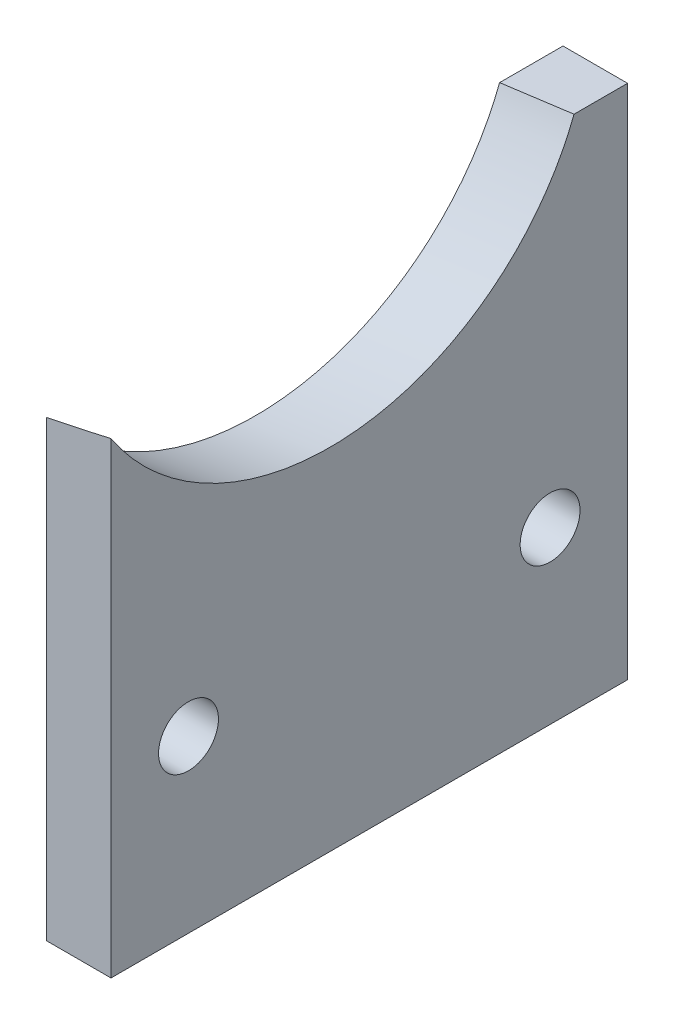
from build123d import *

# Parameters (mm, degrees)
SKETCH1_W           = 25.4
SKETCH1_H           = 25.4
BOSS_EXTRUDE1_DEPTH = 3.175
SKETCH6_R           = 1.4732
CUT_EXTRUDE2_DEPTH  = 19.238986403
SKETCH7_R           = 12.7
BOSS_EXTRUDE2_DEPTH = 2540


with BuildPart() as part:
    # Sketch1 → Boss-Extrude1 (new body)
    with BuildSketch(Plane(origin=(0, 0, 0), x_dir=(0, 0, -1), z_dir=(1, 0, 0))):
        Rectangle(SKETCH1_W, SKETCH1_H)
    extrude(amount=BOSS_EXTRUDE1_DEPTH)

    # Sketch6 → Cut-Extrude2 (cut, symmetric)
    with BuildSketch(Plane.ZY):
        with Locations((-8.889941847, -4.308950185)):
            Circle(SKETCH6_R)
    cut_extrude2 = extrude(amount=CUT_EXTRUDE2_DEPTH, both=True, mode=Mode.SUBTRACT)

    # Mirror2: Cut-Extrude2 across plane
    add(cut_extrude2.mirror(Plane.XY), mode=Mode.SUBTRACT)


with BuildPart() as body_2:
    # Sketch7 → Boss-Extrude2 (new body)
    with BuildSketch(Plane(origin=(-131.213910538, 17.213875686, 22.485057707), x_dir=(0.15111169723467485, 0, 0.9885166943248131), z_dir=(-0.988516694324813, 0, 0.15111169723467482))):
        Circle(SKETCH7_R)
    extrude(amount=-BOSS_EXTRUDE2_DEPTH)


with BuildPart() as part_1:
    add(part.part)

    # Combine1: cut body 2
    add(body_2.part, mode=Mode.SUBTRACT)


solid = part_1.part
